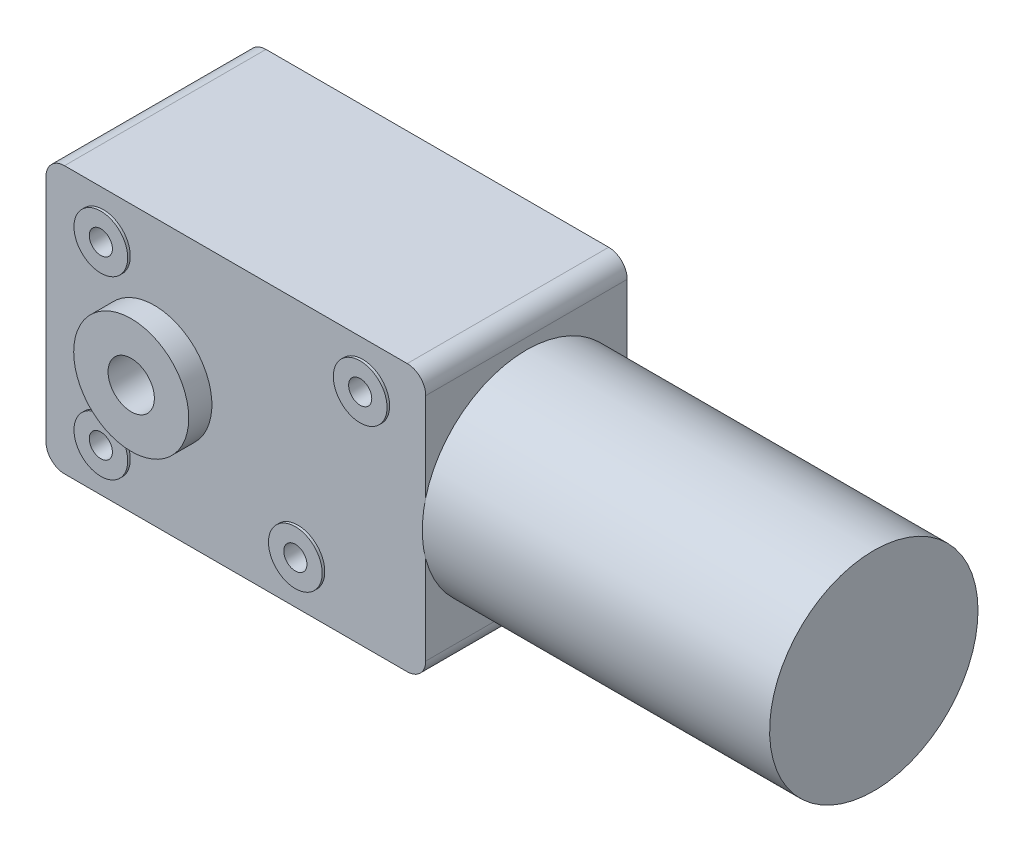
from build123d import *

# Parameters (mm, degrees)
EXTRUDE_1_DEPTH     = 43.5
SKETCH_3_R          = 5.8
SKETCH_3_R_2        = 2.5
EXTRUDE_2_DEPTH     = 0.557471264
SKETCH_3_3_R        = 12.42
SKETCH_3_3_R_2      = 5
EXTRUDE_3_DEPTH     = 5
SKETCH_4_R          = 22.5
EXTRUDE_4_DEPTH     = 75
CUT_EXTRUDE_START   = -10
SKETCH_3_4_R        = 5
CUT_EXTRUDE_1_DEPTH = 10
SKETCH_5_R          = 2.5
CUT_EXTRUDE_2_DEPTH = 10


with BuildPart() as part:
    # 스케치2 → 보스-돌출1 (new body)
    with BuildSketch(Plane.XY):
        with BuildLine():
            Line((-37, 28.82), (37, 28.82))
            ThreePointArc((37, 28.82), (39.828427125, 27.648427125), (41, 24.82))
            Line((41, 24.82), (41, -24.82))
            ThreePointArc((41, -24.82), (39.828427125, -27.648427125), (37, -28.82))
            Line((37, -28.82), (-37, -28.82))
            ThreePointArc((-37, -28.82), (-39.828427125, -27.648427125), (-41, -24.82))
            Line((-41, -24.82), (-41, 24.82))
            ThreePointArc((-41, 24.82), (-39.828427125, 27.648427125), (-37, 28.82))
        make_face()
    extrude(amount=EXTRUDE_1_DEPTH)

    # 스케치3 → 보스-돌출2 (add)
    # profile 1 of 4: a face of its own
    with BuildSketch(Plane.XY.offset(43.5)):
        with Locations((-28.6, 19)):
            Circle(SKETCH_3_R)
        with Locations((-28.6, 19)):
            Circle(SKETCH_3_R_2, mode=Mode.SUBTRACT)
    # profile 2 of 4: a face of its own
    with BuildSketch(Plane.XY.offset(43.5)):
        with Locations((-28.6, -19)):
            Circle(SKETCH_3_R)
        with Locations((-28.6, -19)):
            Circle(SKETCH_3_R_2, mode=Mode.SUBTRACT)
    # profile 3 of 4: a face of its own
    with BuildSketch(Plane.XY.offset(43.5)):
        with Locations((27.4, 19)):
            Circle(SKETCH_3_R)
        with Locations((27.4, 19)):
            Circle(SKETCH_3_R_2, mode=Mode.SUBTRACT)
    # profile 4 of 4: a face of its own
    with BuildSketch(Plane.XY.offset(43.5)):
        with Locations((13.4, -19)):
            Circle(SKETCH_3_R)
        with Locations((13.4, -19)):
            Circle(SKETCH_3_R_2, mode=Mode.SUBTRACT)
    extrude_2 = extrude(amount=EXTRUDE_2_DEPTH)

    # 스케치3<3> → 보스-돌출3 (add)
    with BuildSketch(Plane.XY.offset(43.5)):
        with Locations((-17.6, 0)):
            Circle(SKETCH_3_3_R)
        with Locations((-17.6, 0)):
            Circle(SKETCH_3_3_R_2, mode=Mode.SUBTRACT)
    extrude(amount=EXTRUDE_3_DEPTH)

    # 스케치4 → 보스-돌출4 (add)
    with BuildSketch(Plane(origin=(41, 0, 0), x_dir=(0, 0, -1), z_dir=(1, 0, 0))):
        with Locations((-21.75, 0)):
            Circle(SKETCH_4_R)
    extrude(amount=EXTRUDE_4_DEPTH)

    # 스케치3<4> → 컷-돌출1 (cut)
    with BuildSketch(Plane.XY.offset(43.5).offset(CUT_EXTRUDE_START)):
        with Locations((-17.6, 0)):
            Circle(SKETCH_3_4_R)
    extrude(amount=CUT_EXTRUDE_1_DEPTH, mode=Mode.SUBTRACT)

    # 스케치5 → 컷-돌출2 (cut)
    with BuildSketch(Plane.XY.offset(43.5).offset(CUT_EXTRUDE_START)):
        with Locations((27.4, 19)):
            Circle(SKETCH_5_R)
        with Locations((13.4, -19)):
            Circle(SKETCH_5_R)
        with Locations((-28.6, -19)):
            Circle(SKETCH_5_R)
        with Locations((-28.6, 19)):
            Circle(SKETCH_5_R)
    cut_extrude_2 = extrude(amount=CUT_EXTRUDE_2_DEPTH, mode=Mode.SUBTRACT)

    # 대칭 복사1: 보스-돌출2, 컷-돌출2 across plane
    add(extrude_2.mirror(Plane.XY.offset(21.75)))
    add(cut_extrude_2.mirror(Plane.XY.offset(21.75)), mode=Mode.SUBTRACT)


solid = part.part
